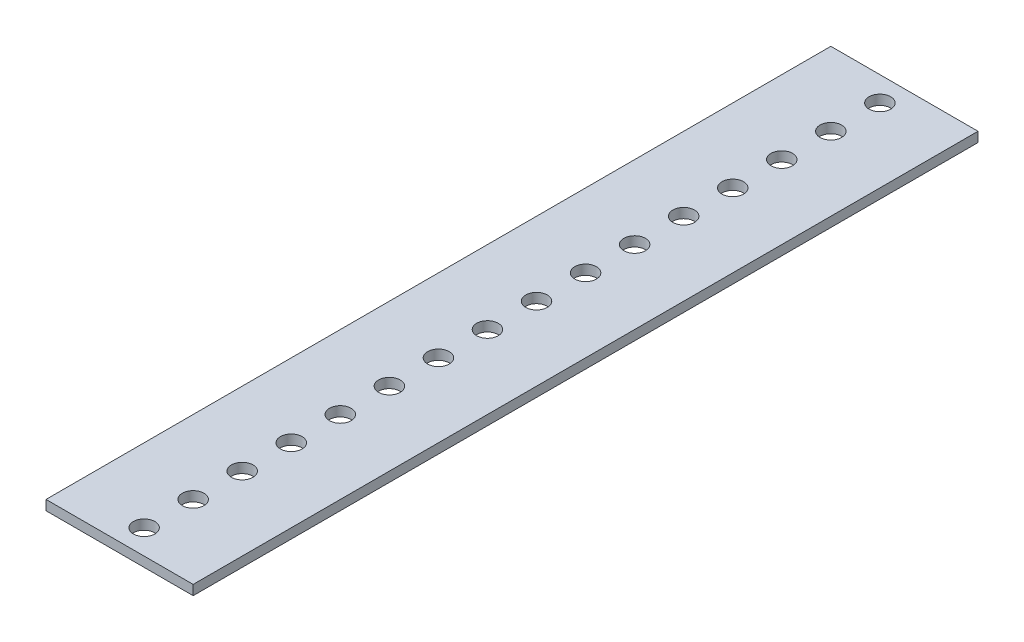
from build123d import *

# Parameters (mm, degrees)
SKETCH2_W           = 38.1
SKETCH2_H           = 203.2
BOSS_EXTRUDE1_DEPTH = 2.54
SKETCH3_R           = 2.794
CUT_EXTRUDE1_DEPTH  = 2.54
LPATTERN1_COUNT     = 16
LPATTERN1_PITCH     = 12.7


with BuildPart() as part:
    # Sketch2 → Boss-Extrude1 (new body)
    with BuildSketch(Plane(origin=(0, 0, 0), x_dir=(1, 0, 0), z_dir=(0, 1, 0))):
        Rectangle(SKETCH2_W, SKETCH2_H)
    extrude(amount=BOSS_EXTRUDE1_DEPTH)

    # Sketch3 → Cut-Extrude1 (cut)
    with BuildSketch(Plane(origin=(0, 2.54, 0), x_dir=(1, 0, 0), z_dir=(0, 1, 0))):
        with Locations((0, -95.25)):
            Circle(SKETCH3_R)
    cut_extrude1 = extrude(amount=-CUT_EXTRUDE1_DEPTH, mode=Mode.SUBTRACT)

    # LPattern1: Cut-Extrude1 ×16
    with Locations(*[(0, 0, -i * LPATTERN1_PITCH) for i in range(1, LPATTERN1_COUNT)]):
        add(cut_extrude1, mode=Mode.SUBTRACT)


solid = part.part
